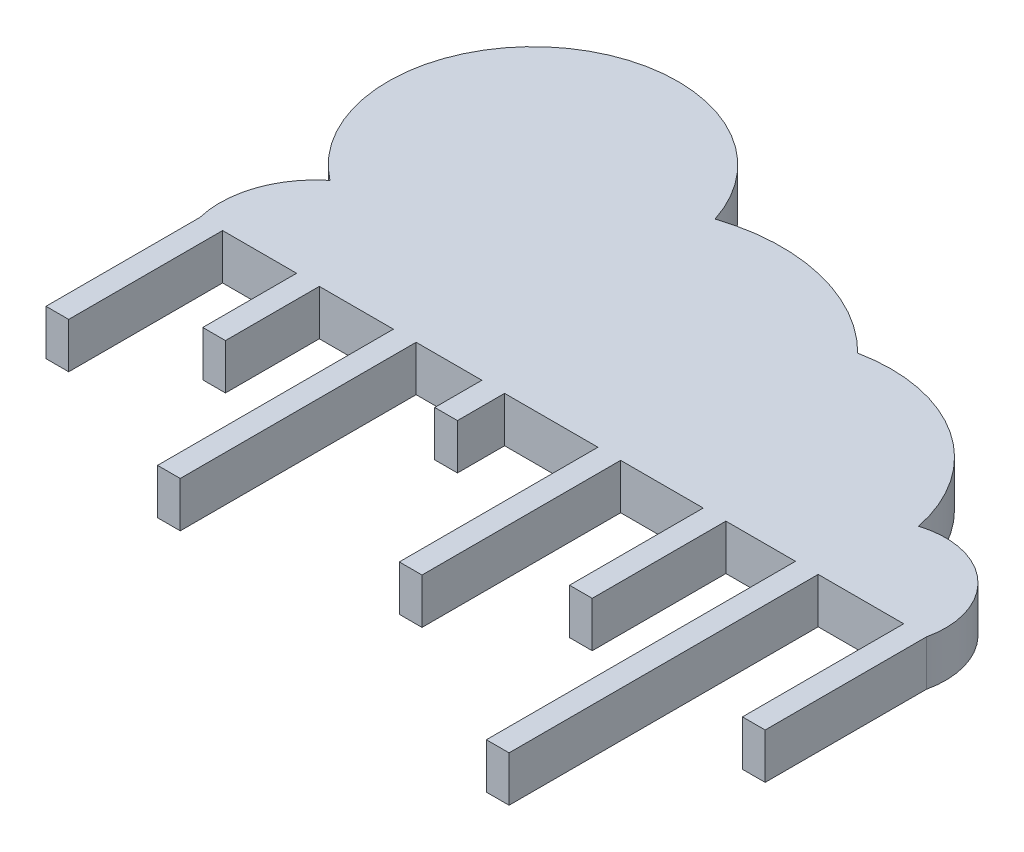
from build123d import *

# Parameters (mm, degrees)
CLOUD_DEPTH         = 6.35
BOSS_EXTRUDE2_DEPTH = 6.35
SKETCH3_W           = 3.175
SKETCH3_H           = 21.521021789
SKETCH3_H_2         = 22.551025745
SKETCH3_H_3         = 18.697678286
SKETCH3_H_4         = 6.593217504
SKETCH3_H_5         = 27.776023872
SKETCH3_H_6         = 13.123255557
SKETCH3_H_7         = 43.225138291
SKETCH3_H_8         = 32.986564802
BOSS_EXTRUDE3_DEPTH = 6.35
SHELL1_T            = -0.635


with BuildPart() as part:
    # Sketch1 → cloud (new body)
    with BuildSketch(Plane(origin=(0, 0, 0), x_dir=(1, 0, 0), z_dir=(0, 1, 0))):
        with BuildLine():
            Line((0, 0), (101.6, 0))
            ThreePointArc((101.6, 0), (98.343989091, 10.461425209), (87.651021829, 12.849620257))
            ThreePointArc((87.651021829, 12.849620257), (78.506319348, 26.425615334), (62.440360032, 29.559012378))
            ThreePointArc((62.440360032, 29.559012378), (36.216521114, 35.827379731), (18.859138476, 15.194798099))
            ThreePointArc((18.859138476, 15.194798099), (4.606314106, 13.583818602), (0, 0))
        make_face()
    extrude(amount=CLOUD_DEPTH)

    # Sketch2 → Boss-Extrude2 (add)
    with BuildSketch(Plane(origin=(0, 0, 0), x_dir=(1, 0, 0), z_dir=(0, 1, 0))):
        with BuildLine():
            ThreePointArc((4.606314106, 13.583818602), (5.274143161, 46.217099781), (36.216521114, 35.827379731))
            ThreePointArc((36.216521114, 35.827379731), (24.610310236, 27.973896434), (18.859138476, 15.194798099))
            ThreePointArc((18.859138476, 15.194798099), (11.498636165, 16.46037472), (4.606314106, 13.583818602))
        make_face()
    extrude(amount=BOSS_EXTRUDE2_DEPTH)

    # Sketch3 → Boss-Extrude3 (add)
    with BuildSketch(Plane(origin=(0, 0, 0), x_dir=(1, 0, 0), z_dir=(0, 1, 0))):
        with Locations((1.5875, -10.760510895)):
            Rectangle(SKETCH3_W, SKETCH3_H)
        with Locations((100.0125, -11.275512873)):
            Rectangle(SKETCH3_W, SKETCH3_H_2)
        with Locations((71.975119488, -9.348839143)):
            Rectangle(SKETCH3_W, SKETCH3_H_3)
        with Locations((41.02352553, -3.296608752)):
            Rectangle(SKETCH3_W, SKETCH3_H_4)
        with Locations((57.251074994, -13.888011936)):
            Rectangle(SKETCH3_W, SKETCH3_H_5)
        with Locations((15.112632472, -6.561627779)):
            Rectangle(SKETCH3_W, SKETCH3_H_6)
        with Locations((84.875926374, -21.612569146)):
            Rectangle(SKETCH3_W, SKETCH3_H_7)
        with Locations((28.651643975, -16.493282401)):
            Rectangle(SKETCH3_W, SKETCH3_H_8)
    extrude(amount=BOSS_EXTRUDE3_DEPTH)

    # Shell1
    shell1_openings = [part.faces().sort_by_distance(p)[0] for p in [
        (42.513286285, 0, -14.475383052),
    ]]
    offset(amount=SHELL1_T, openings=shell1_openings, kind=Kind.INTERSECTION)


solid = part.part
